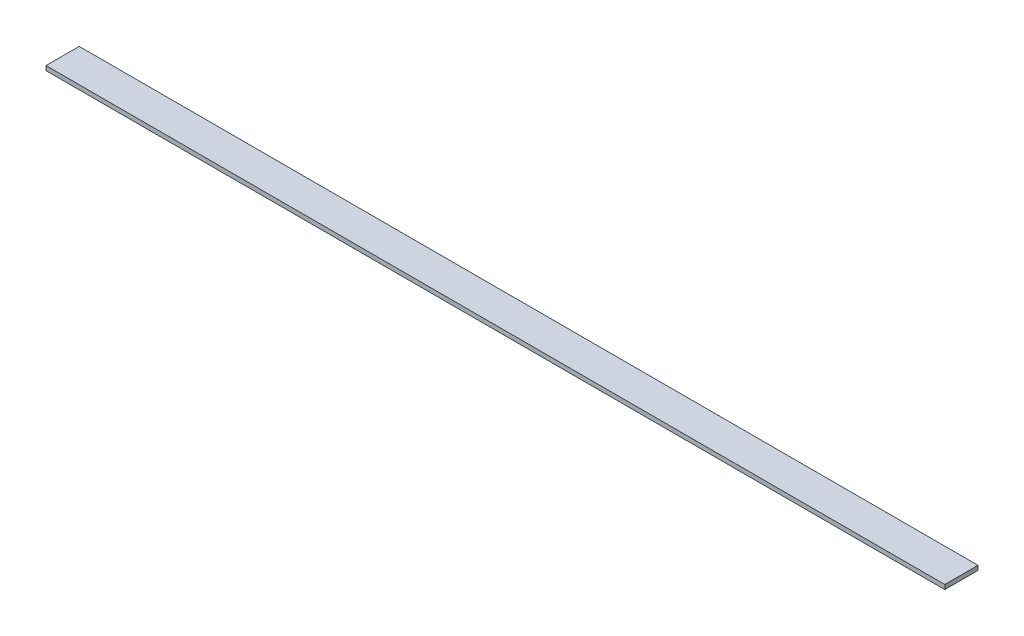
from build123d import *

# Parameters (mm, degrees)
SKETCH_1_W             = 15
SKETCH_1_H             = 2
SM_BASE_FLANGE_1_DEPTH = 406


# Sheet-metal steps are written as plain solids
with BuildPart() as part:
    # Sketch 1 → Базовая кромка1 (new body)
    with BuildSketch(Plane(origin=(0, 0, 0), x_dir=(0, 0, -1), z_dir=(1, 0, 0))):
        with Locations((7.5, 1)):
            Rectangle(SKETCH_1_W, SKETCH_1_H)
    extrude(amount=-SM_BASE_FLANGE_1_DEPTH)


solid = part.part
